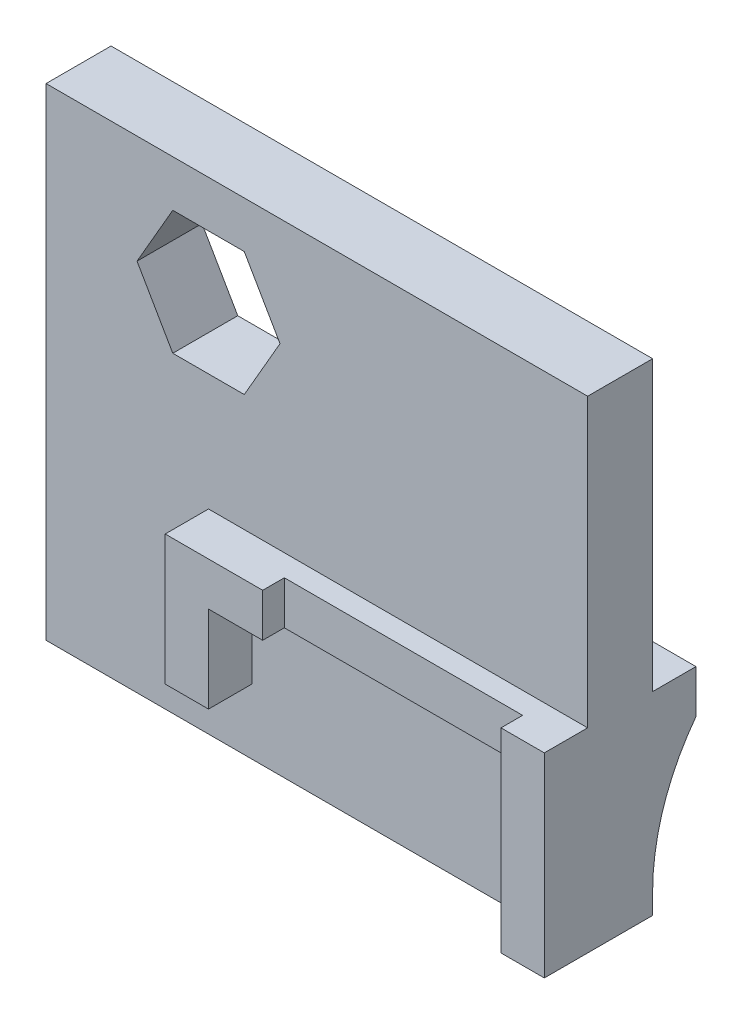
from build123d import *

# Parameters (mm, degrees)
ESQUISSE1_W             = 25
ESQUISSE1_H             = 22.257883832
BOSS_EXTRU_1_DEPTH      = 3
ESQUISSE2_W             = 25
ESQUISSE2_H             = 2
BOSS_EXTRU_2_DEPTH      = 2
BOSS_EXTRU_3_DEPTH      = 2
ESQUISSE6_W             = 11
ESQUISSE6_H             = 2
ENL_V_MAT_EXTRU_2_DEPTH = 1
CONG_1_R                = 10


with BuildPart() as part:
    # Esquisse1 → Boss.-Extru.1 (new body)
    with BuildSketch(Plane.XY):
        with Locations((5, -6.128941916)):
            Rectangle(ESQUISSE1_W, ESQUISSE1_H)
        Polygon((1.65, -2.857883832), (3.3, 0), (1.65, 2.857883832), (-1.65, 2.857883832), (-3.3, 0), (-1.65, -2.857883832), align=None, mode=Mode.SUBTRACT)
    extrude(amount=BOSS_EXTRU_1_DEPTH)

    # Esquisse2 → Boss.-Extru.2 (add)
    with BuildSketch(Plane(origin=(0, 0, 0), x_dir=(-1, 0, 0), z_dir=(0, 0, -1))):
        with Locations((-5, -9.307883832)):
            Rectangle(ESQUISSE2_W, ESQUISSE2_H)
    extrude(amount=BOSS_EXTRU_2_DEPTH)

    # Esquisse3 → Boss.-Extru.3 (add)
    with BuildSketch(Plane.XY.offset(3)):
        Polygon((0, -8.257883832), (17.5, -8.257883832), (17.5, -17.257883832), (15.5, -17.257883832), (15.5, -10.257883832), (2, -10.257883832), (2, -14.257883832), (0, -14.257883832), align=None)
    extrude(amount=BOSS_EXTRU_3_DEPTH)

    # Esquisse6 → Enlèv. mat.-Extru.2 (cut)
    with BuildSketch(Plane.XY.offset(5)):
        with Locations((10, -9.257883832)):
            Rectangle(ESQUISSE6_W, ESQUISSE6_H)
    extrude(amount=-ENL_V_MAT_EXTRU_2_DEPTH, mode=Mode.SUBTRACT)

    # Congé1
    # the kernel refuses this fillet: 10 mm, written as the material it adds along each edge
    with BuildSketch(Plane(origin=(17.5, -10.307883832, 0), x_dir=(0, -1, 0), z_dir=(-1, 0, 0))) as cong_1_piece_1:
        with BuildLine():
            CenterArc((6, -10), CONG_1_R, 90, 36.869897646)
            Line((0, -2), (0, 0))
            Line((0, 0), (6, 0))
        make_face()
    extrude(amount=25)


solid = part.part
